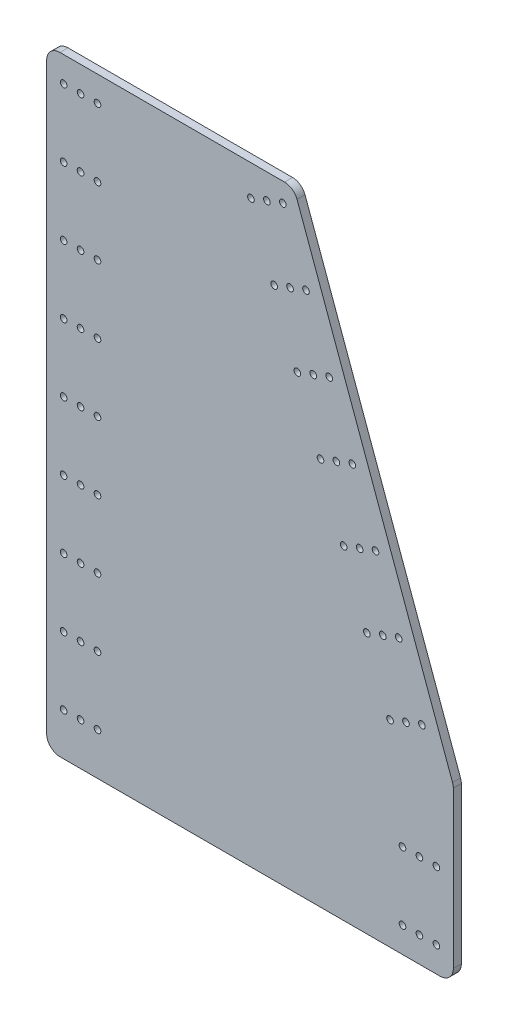
from build123d import *

# Parameters (mm, degrees)
BOSS_EXTRUDE1_DEPTH = 6
FILLET1_R           = 10
SKETCH2_R           = 2.4892
CUT_EXTRUDE1_DEPTH  = 550.51877129


with BuildPart() as part:
    # Sketch1 → Boss-Extrude1 (new body)
    with BuildSketch(Plane.XY):
        Polygon((268.470039594, 228.6), (185.266444041, 457.2), (0, 457.2), (0, 0), (304.8, 0), (304.8, 128.784254135), align=None)
    extrude(amount=BOSS_EXTRUDE1_DEPTH)

    # Fillet1
    fillet1_edges = [part.edges().sort_by_distance(p)[0] for p in [
        (304.8, 0, 3),
        (304.8, 128.784254135, 3),
        (0, 0, 3),
        (185.266444041, 457.2, 3),
        (0, 457.2, 3),
    ]]
    fillet(fillet1_edges, radius=FILLET1_R)

    # Sketch2 → Cut-Extrude1 (cut, through all)
    with BuildSketch(Plane.XY.offset(6)):
        with Locations((12.7, 438.15)):
            Circle(SKETCH2_R)
        with Locations((25.4, 438.15)):
            Circle(SKETCH2_R)
        with Locations((38.1, 438.15)):
            Circle(SKETCH2_R)
        with Locations((266.7, 19.05)):
            Circle(SKETCH2_R)
        with Locations((279.4, 19.05)):
            Circle(SKETCH2_R)
        with Locations((292.1, 19.05)):
            Circle(SKETCH2_R)
        with Locations((12.7, 387.35)):
            Circle(SKETCH2_R)
        with Locations((25.4, 387.35)):
            Circle(SKETCH2_R)
        with Locations((38.1, 387.35)):
            Circle(SKETCH2_R)
        with Locations((12.7, 336.55)):
            Circle(SKETCH2_R)
        with Locations((25.4, 336.55)):
            Circle(SKETCH2_R)
        with Locations((38.1, 336.55)):
            Circle(SKETCH2_R)
        with Locations((12.7, 285.75)):
            Circle(SKETCH2_R)
        with Locations((25.4, 285.75)):
            Circle(SKETCH2_R)
        with Locations((38.1, 285.75)):
            Circle(SKETCH2_R)
        with Locations((12.7, 234.95)):
            Circle(SKETCH2_R)
        with Locations((25.4, 234.95)):
            Circle(SKETCH2_R)
        with Locations((38.1, 234.95)):
            Circle(SKETCH2_R)
        with Locations((12.7, 184.15)):
            Circle(SKETCH2_R)
        with Locations((25.4, 184.15)):
            Circle(SKETCH2_R)
        with Locations((38.1, 184.15)):
            Circle(SKETCH2_R)
        with Locations((12.7, 133.35)):
            Circle(SKETCH2_R)
        with Locations((25.4, 133.35)):
            Circle(SKETCH2_R)
        with Locations((38.1, 133.35)):
            Circle(SKETCH2_R)
        with Locations((12.7, 82.55)):
            Circle(SKETCH2_R)
        with Locations((25.4, 82.55)):
            Circle(SKETCH2_R)
        with Locations((38.1, 82.55)):
            Circle(SKETCH2_R)
        with Locations((12.7, 31.75)):
            Circle(SKETCH2_R)
        with Locations((25.4, 31.75)):
            Circle(SKETCH2_R)
        with Locations((38.1, 31.75)):
            Circle(SKETCH2_R)
        with Locations((176.985779996, 442.8186216)):
            Circle(SKETCH2_R)
        with Locations((165.051683712, 438.47496578)):
            Circle(SKETCH2_R)
        with Locations((153.117587428, 434.13130996)):
            Circle(SKETCH2_R)
        with Locations((266.7, 69.85)):
            Circle(SKETCH2_R)
        with Locations((279.4, 69.85)):
            Circle(SKETCH2_R)
        with Locations((292.1, 69.85)):
            Circle(SKETCH2_R)
        with Locations((170.492210709, 386.394924824)):
            Circle(SKETCH2_R)
        with Locations((182.426306993, 390.738580644)):
            Circle(SKETCH2_R)
        with Locations((194.360403277, 395.082236464)):
            Circle(SKETCH2_R)
        with Locations((187.86683399, 338.658539688)):
            Circle(SKETCH2_R)
        with Locations((199.800930274, 343.002195508)):
            Circle(SKETCH2_R)
        with Locations((211.735026558, 347.345851328)):
            Circle(SKETCH2_R)
        with Locations((205.241457271, 290.922154552)):
            Circle(SKETCH2_R)
        with Locations((217.175553555, 295.265810372)):
            Circle(SKETCH2_R)
        with Locations((229.109649839, 299.609466192)):
            Circle(SKETCH2_R)
        with Locations((222.616080552, 243.185769416)):
            Circle(SKETCH2_R)
        with Locations((234.550176836, 247.529425236)):
            Circle(SKETCH2_R)
        with Locations((246.48427312, 251.873081056)):
            Circle(SKETCH2_R)
        with Locations((239.990703833, 195.44938428)):
            Circle(SKETCH2_R)
        with Locations((251.924800117, 199.7930401)):
            Circle(SKETCH2_R)
        with Locations((263.858896401, 204.13669592)):
            Circle(SKETCH2_R)
        with Locations((257.365327114, 147.712999144)):
            Circle(SKETCH2_R)
        with Locations((269.299423398, 152.056654964)):
            Circle(SKETCH2_R)
        with Locations((281.233519682, 156.400310784)):
            Circle(SKETCH2_R)
    extrude(amount=-CUT_EXTRUDE1_DEPTH, mode=Mode.SUBTRACT)


solid = part.part
